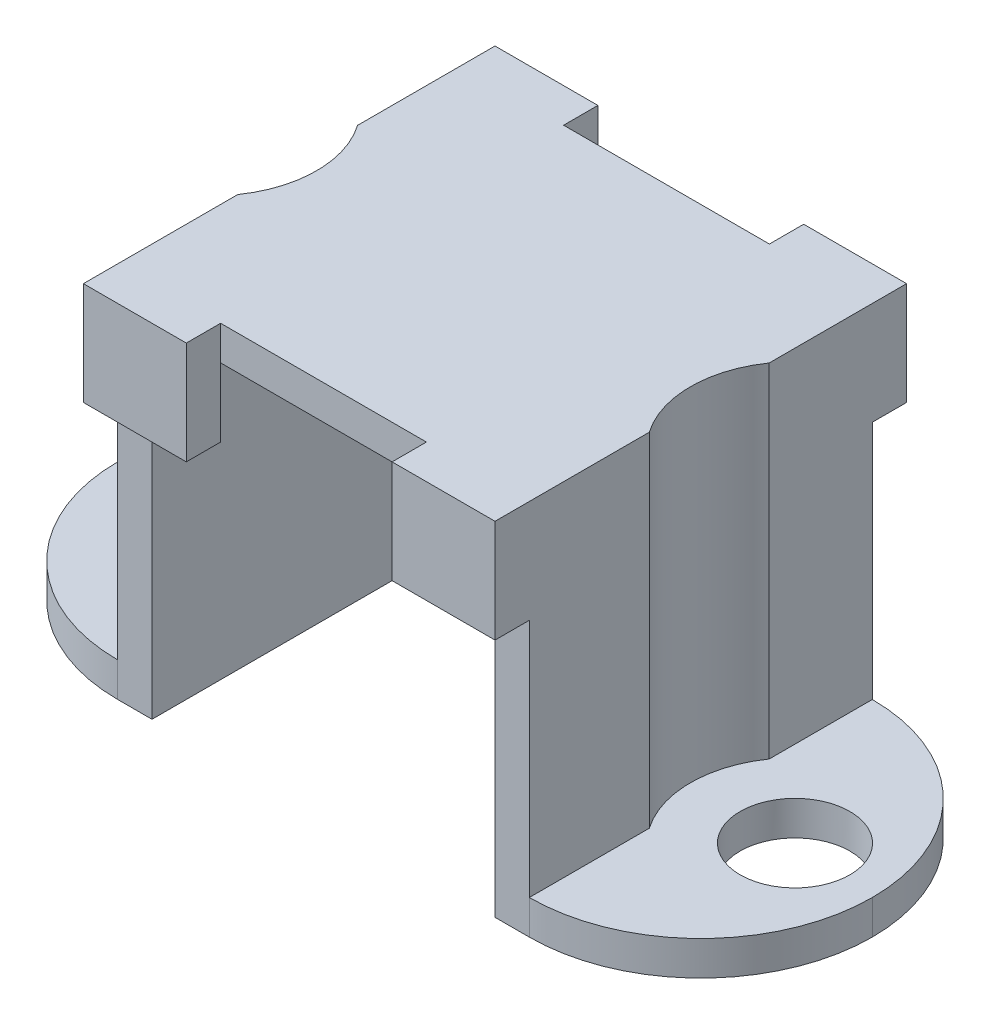
from build123d import *

# Parameters (mm, degrees)
SKETCH1_W           = 6
SKETCH1_H           = 10
BOSS_EXTRUDE1_DEPTH = 1
SKETCH2_W           = 1
SKETCH2_H           = 10
BOSS_EXTRUDE2_DEPTH = 10
SKETCH3_W           = 10
SKETCH3_H           = 1
BOSS_EXTRUDE3_DEPTH = 5
CUT_EXTRUDE1_REACH  = 17.684
SKETCH4_R           = 1.6
CUT_EXTRUDE6_START  = -10
SKETCH5_R           = 3.05
CUT_EXTRUDE6_DEPTH  = 10
SKETCH6_W           = 3
SKETCH6_H           = 3
BOSS_EXTRUDE4_DEPTH = 1
SKETCH7_W           = 3
SKETCH7_H           = 3
BOSS_EXTRUDE5_DEPTH = 1
FILLET2_R           = 5


with BuildPart() as part:
    # Sketch1 → Boss-Extrude1 (new body)
    with BuildSketch(Plane(origin=(0, 0, 0), x_dir=(1, 0, 0), z_dir=(0, 1, 0))):
        with Locations((3, 0)):
            Rectangle(SKETCH1_W, SKETCH1_H)
    extrude(amount=BOSS_EXTRUDE1_DEPTH)

    # Sketch2 → Boss-Extrude2 (add)
    with BuildSketch(Plane.XZ):
        with Locations((5.5, 0)):
            Rectangle(SKETCH2_W, SKETCH2_H)
    extrude(amount=BOSS_EXTRUDE2_DEPTH)

    # Sketch3 → Boss-Extrude3 (add)
    with BuildSketch(Plane(origin=(6, 0, 0), x_dir=(0, 0, -1), z_dir=(1, 0, 0))):
        with Locations((0, -9.5)):
            Rectangle(SKETCH3_W, SKETCH3_H)
    extrude(amount=BOSS_EXTRUDE3_DEPTH)

    # Sketch4 → Cut-Extrude1 (cut, up to next)
    with BuildSketch(Plane(origin=(0, -9, 0), x_dir=(1, 0, 0), z_dir=(0, 1, 0)), mode=Mode.PRIVATE) as cut_extrude1_sk1:
        with Locations(Location((8.5, 0.246614642, 0), (0, 0, 270))):
            Circle(SKETCH4_R)
    cut_extrude1_tool1 = extrude(cut_extrude1_sk1.sketch, amount=-CUT_EXTRUDE1_REACH, mode=Mode.PRIVATE) & part.part
    add(cut_extrude1_tool1.solids().sort_by_distance((8.5, -9, -0.246615))[0], mode=Mode.SUBTRACT)

    # Sketch5 → Cut-Extrude6 (cut)
    with BuildSketch(Plane(origin=(0, 1, 0), x_dir=(1, 0, 0), z_dir=(0, 1, 0)).offset(CUT_EXTRUDE6_START)):
        with Locations((8.5, 0.246614642)):
            Circle(SKETCH5_R)
    extrude(amount=CUT_EXTRUDE6_DEPTH, mode=Mode.SUBTRACT)

    # Sketch6 → Boss-Extrude4 (add)
    with BuildSketch(Plane(origin=(0, 0, -5), x_dir=(-1, 0, 0), z_dir=(0, 0, -1))):
        with Locations((-4.5, -0.5)):
            Rectangle(SKETCH6_W, SKETCH6_H)
    extrude(amount=BOSS_EXTRUDE4_DEPTH)

    # Sketch7 → Boss-Extrude5 (add)
    with BuildSketch(Plane.XY.offset(5)):
        with Locations((4.5, -0.5)):
            Rectangle(SKETCH7_W, SKETCH7_H)
    extrude(amount=BOSS_EXTRUDE5_DEPTH)

    # Fillet2
    fillet2_edges = [part.edges().sort_by_distance(p)[0] for p in [
        (11, -9.5, 5),
        (11, -9.5, -5),
    ]]
    fillet(fillet2_edges, radius=FILLET2_R - 0.0001)  # a hair under: the kernel refuses the full size

    # Mirror1: part across plane


with BuildPart() as part_1:
    add(part.part)
    add(part.part.mirror(Plane(origin=(0, 0, 0), x_dir=(0, 0, 1), z_dir=(1, 0, 0))))


solid = part_1.part
